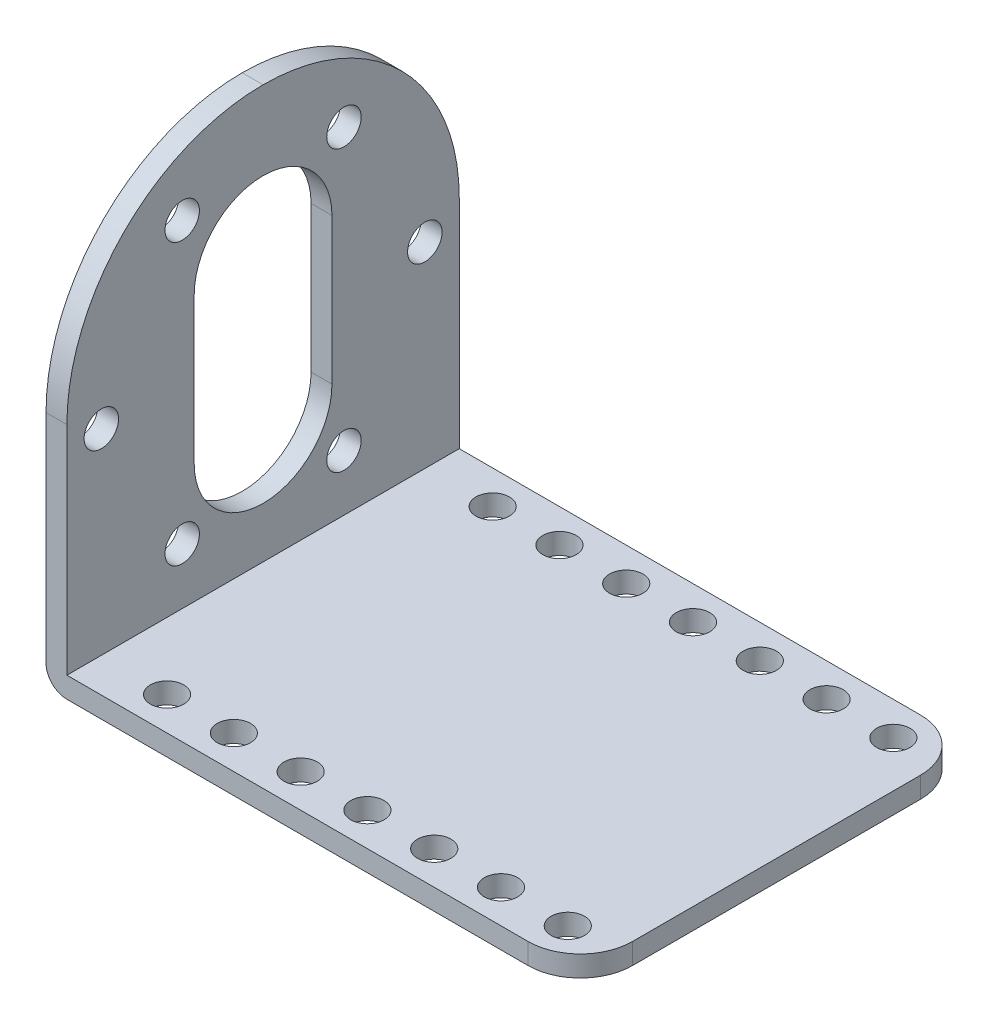
from build123d import *

# Parameters (mm, degrees)
SKETCH1_W           = 51.2
SKETCH1_H           = 37.6
SKETCH1_R           = 1.6
BOSS_EXTRUDE1_DEPTH = 2
FILLET2_R           = 5
SKETCH2_W           = 2
SKETCH2_H           = 37.6
BOSS_EXTRUDE2_DEPTH = 39.6
CUT_EXTRUDE1_REACH  = 70.596
SKETCH3_R           = 1.65
FILLET3_R           = 18.8
FILLET4_R           = 2


with BuildPart() as part:
    # Sketch1 → Boss-Extrude1 (new body)
    with BuildSketch(Plane(origin=(0, 0, 0), x_dir=(1, 0, 0), z_dir=(0, 1, 0))):
        Rectangle(SKETCH1_W, SKETCH1_H)
        with Locations(Location((-17.2, 15.6, 0), (0, 0, 270))):
            Circle(SKETCH1_R, mode=Mode.SUBTRACT)
        with Locations(Location((-10.8, 15.6, 0), (0, 0, 270))):
            Circle(SKETCH1_R, mode=Mode.SUBTRACT)
        with Locations(Location((-4.4, 15.6, 0), (0, 0, 270))):
            Circle(SKETCH1_R, mode=Mode.SUBTRACT)
        with Locations(Location((2, 15.6, 0), (0, 0, 270))):
            Circle(SKETCH1_R, mode=Mode.SUBTRACT)
        with Locations(Location((8.4, 15.6, 0), (0, 0, 270))):
            Circle(SKETCH1_R, mode=Mode.SUBTRACT)
        with Locations(Location((14.8, 15.6, 0), (0, 0, 270))):
            Circle(SKETCH1_R, mode=Mode.SUBTRACT)
        with Locations(Location((21.2, 15.6, 0), (0, 0, 270))):
            Circle(SKETCH1_R, mode=Mode.SUBTRACT)
        with Locations(Location((21.2, -15.6, 0), (0, 0, 90))):
            Circle(SKETCH1_R, mode=Mode.SUBTRACT)
        with Locations(Location((14.8, -15.6, 0), (0, 0, 90))):
            Circle(SKETCH1_R, mode=Mode.SUBTRACT)
        with Locations(Location((8.4, -15.6, 0), (0, 0, 90))):
            Circle(SKETCH1_R, mode=Mode.SUBTRACT)
        with Locations(Location((2, -15.6, 0), (0, 0, 90))):
            Circle(SKETCH1_R, mode=Mode.SUBTRACT)
        with Locations(Location((-4.4, -15.6, 0), (0, 0, 90))):
            Circle(SKETCH1_R, mode=Mode.SUBTRACT)
        with Locations(Location((-10.8, -15.6, 0), (0, 0, 90))):
            Circle(SKETCH1_R, mode=Mode.SUBTRACT)
        with Locations(Location((-17.2, -15.6, 0), (0, 0, 90))):
            Circle(SKETCH1_R, mode=Mode.SUBTRACT)
    extrude(amount=BOSS_EXTRUDE1_DEPTH)

    # Fillet2
    fillet2_edges = [part.edges().sort_by_distance(p)[0] for p in [
        (25.6, 1, 18.8),
        (25.6, 1, -18.8),
    ]]
    fillet(fillet2_edges, radius=FILLET2_R)

    # Sketch2 → Boss-Extrude2 (add)
    with BuildSketch(Plane(origin=(0, 2, 0), x_dir=(1, 0, 0), z_dir=(0, 1, 0))):
        with Locations((-24.6, 0)):
            Rectangle(SKETCH2_W, SKETCH2_H)
    extrude(amount=BOSS_EXTRUDE2_DEPTH)

    # Sketch3 → Cut-Extrude1 (cut, up to next)
    with BuildSketch(Plane.ZY.offset(25.6), mode=Mode.PRIVATE) as cut_extrude1_sk1:
        with Locations((7.75, 34.223393759)):
            Circle(SKETCH3_R)
    cut_extrude1_tool1 = extrude(cut_extrude1_sk1.sketch, amount=-CUT_EXTRUDE1_REACH, mode=Mode.PRIVATE) & part.part
    # Sketch3 → Cut-Extrude1 (cut, up to next)
    with BuildSketch(Plane.ZY.offset(25.6), mode=Mode.PRIVATE) as cut_extrude1_sk2:
        with Locations((15.5, 20.8)):
            Circle(SKETCH3_R)
    cut_extrude1_tool2 = extrude(cut_extrude1_sk2.sketch, amount=-CUT_EXTRUDE1_REACH, mode=Mode.PRIVATE) & part.part
    # Sketch3 → Cut-Extrude1 (cut, up to next)
    with BuildSketch(Plane.ZY.offset(25.6), mode=Mode.PRIVATE) as cut_extrude1_sk3:
        with Locations((7.75, 7.376606241)):
            Circle(SKETCH3_R)
    cut_extrude1_tool3 = extrude(cut_extrude1_sk3.sketch, amount=-CUT_EXTRUDE1_REACH, mode=Mode.PRIVATE) & part.part
    # Sketch3 → Cut-Extrude1 (cut, up to next)
    with BuildSketch(Plane.ZY.offset(25.6), mode=Mode.PRIVATE) as cut_extrude1_sk4:
        with Locations((-7.75, 7.376606241)):
            Circle(SKETCH3_R)
    cut_extrude1_tool4 = extrude(cut_extrude1_sk4.sketch, amount=-CUT_EXTRUDE1_REACH, mode=Mode.PRIVATE) & part.part
    # Sketch3 → Cut-Extrude1 (cut, up to next)
    with BuildSketch(Plane.ZY.offset(25.6), mode=Mode.PRIVATE) as cut_extrude1_sk5:
        with Locations((-15.5, 20.8)):
            Circle(SKETCH3_R)
    cut_extrude1_tool5 = extrude(cut_extrude1_sk5.sketch, amount=-CUT_EXTRUDE1_REACH, mode=Mode.PRIVATE) & part.part
    # Sketch3 → Cut-Extrude1 (cut, up to next)
    with BuildSketch(Plane.ZY.offset(25.6), mode=Mode.PRIVATE) as cut_extrude1_sk6:
        with Locations((-7.75, 34.223393759)):
            Circle(SKETCH3_R)
    cut_extrude1_tool6 = extrude(cut_extrude1_sk6.sketch, amount=-CUT_EXTRUDE1_REACH, mode=Mode.PRIVATE) & part.part
    # Sketch3 → Cut-Extrude1 (cut, up to next)
    with BuildSketch(Plane.ZY.offset(25.6), mode=Mode.PRIVATE) as cut_extrude1_sk7:
        with BuildLine():
            Line((-6.6, 27.456121665), (-6.6, 13.456121665))
            ThreePointArc((-6.6, 13.456121665), (0, 6.856121665), (6.6, 13.456121665))
            Line((6.6, 13.456121665), (6.6, 27.456121665))
            ThreePointArc((6.6, 27.456121665), (0, 34.056121665), (-6.6, 27.456121665))
        make_face()
    cut_extrude1_tool7 = extrude(cut_extrude1_sk7.sketch, amount=-CUT_EXTRUDE1_REACH, mode=Mode.PRIVATE) & part.part
    add(cut_extrude1_tool1.solids().sort_by_distance((-25.6, 34.223394, 7.75))[0], mode=Mode.SUBTRACT)
    add(cut_extrude1_tool2.solids().sort_by_distance((-25.6, 20.8, 15.5))[0], mode=Mode.SUBTRACT)
    add(cut_extrude1_tool3.solids().sort_by_distance((-25.6, 7.376606, 7.75))[0], mode=Mode.SUBTRACT)
    add(cut_extrude1_tool4.solids().sort_by_distance((-25.6, 7.376606, -7.75))[0], mode=Mode.SUBTRACT)
    add(cut_extrude1_tool5.solids().sort_by_distance((-25.6, 20.8, -15.5))[0], mode=Mode.SUBTRACT)
    add(cut_extrude1_tool6.solids().sort_by_distance((-25.6, 34.223394, -7.75))[0], mode=Mode.SUBTRACT)
    add(cut_extrude1_tool7.solids().sort_by_distance((-25.6, 20.456122, 0))[0], mode=Mode.SUBTRACT)

    # Fillet3
    fillet3_edges = [part.edges().sort_by_distance(p)[0] for p in [
        (-24.6, 41.6, -18.8),
        (-24.6, 41.6, 18.8),
    ]]
    fillet(fillet3_edges, radius=FILLET3_R - 0.0001)  # a hair under: the kernel refuses the full size

    # Fillet4
    fillet4_edges = [part.edges().sort_by_distance(p)[0] for p in [
        (-25.6, 0, 0),
    ]]
    fillet(fillet4_edges, radius=FILLET4_R)


solid = part.part
